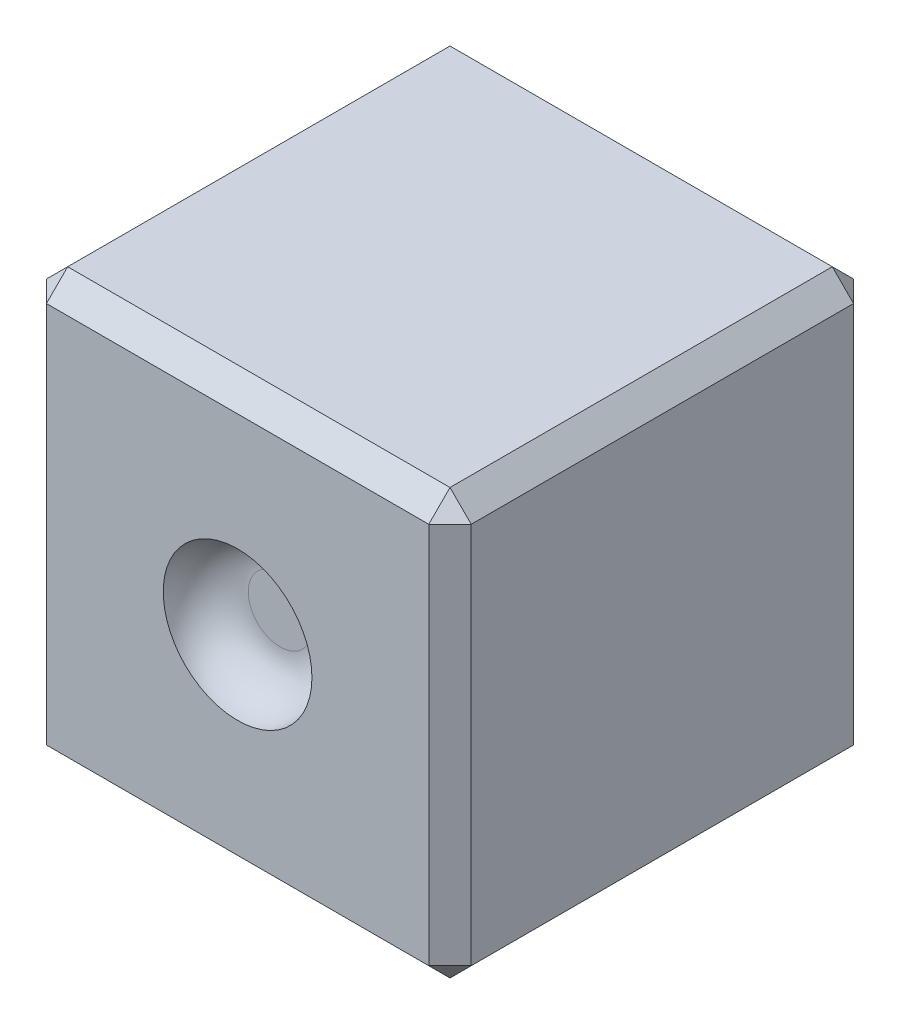
from build123d import *

# Parameters (mm, degrees)
SKETCH_2_W          = 20
SKETCH_2_H          = 20
EXTRUDE_1_DEPTH     = 20
CHAMFER_2_SIZE      = 1
SKETCH_3_R          = 3.5
CUT_EXTRUDE_1_DEPTH = 2
FILLET_1_R          = 2


with BuildPart() as part:
    # ｽｹｯﾁ2 → ﾎﾞｽ - 押し出し1 (new body)
    with BuildSketch(Plane.XY):
        with Locations((-14.586466165, 5.169172932)):
            Rectangle(SKETCH_2_W, SKETCH_2_H)
    extrude(amount=EXTRUDE_1_DEPTH)

    # 面取り2
    chamfer_2_edges = [part.edges().sort_by_distance(p)[0] for p in [
        (-4.586466165, 5.169172932, 20),
        (-14.586466165, 15.169172932, 20),
        (-24.586466165, 5.169172932, 20),
        (-14.586466165, 15.169172932, 0),
        (-4.586466165, 5.169172932, 0),
        (-24.586466165, 15.169172932, 10),
        (-4.586466165, 15.169172932, 10),
        (-4.586466165, -4.830827068, 10),
        (-14.586466165, -4.830827068, 20),
    ]]
    chamfer(chamfer_2_edges, length=CHAMFER_2_SIZE)

    # ｽｹｯﾁ3 → ｶｯﾄ - 押し出し1 (cut)
    with BuildSketch(Plane.XY.offset(20)):
        with Locations((-14.586466165, 5.169172932)):
            Circle(SKETCH_3_R)
    extrude(amount=-CUT_EXTRUDE_1_DEPTH, mode=Mode.SUBTRACT)

    # ﾌｨﾚｯﾄ1
    fillet_1_edges = [part.edges().sort_by_distance(p)[0] for p in [
        (-18.086466165, 5.169172932, 18),
    ]]
    fillet(fillet_1_edges, radius=FILLET_1_R - 0.0001)  # a hair under: the kernel refuses the full size


solid = part.part
